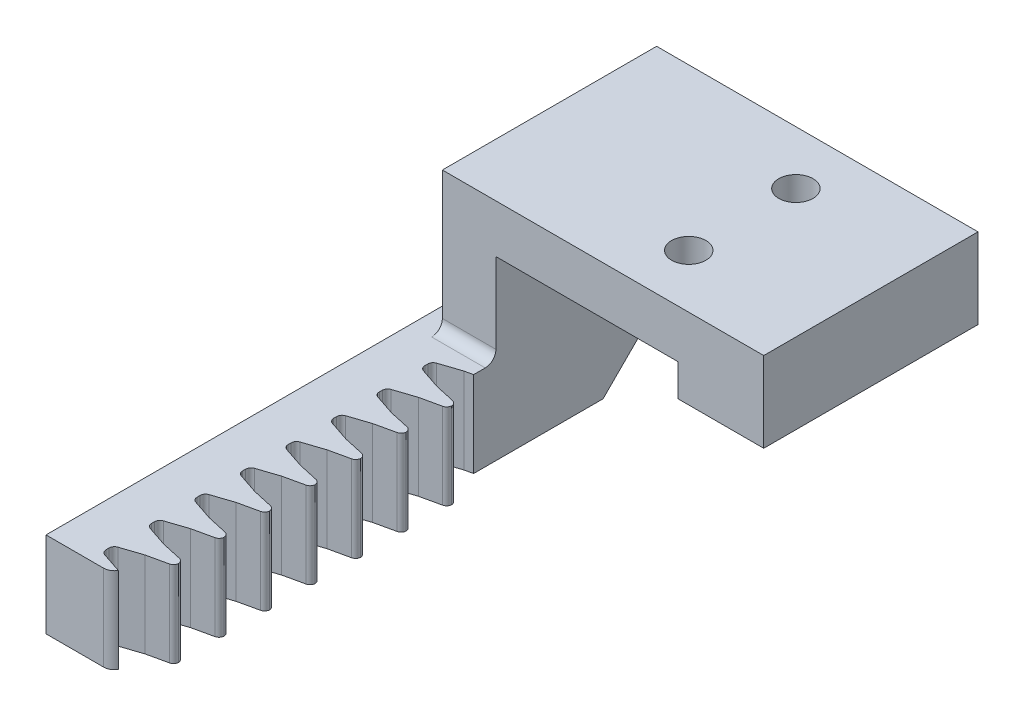
from build123d import *

# Parameters (mm, degrees)
SKETCH1_W           = 30
SKETCH1_H           = 16
BOSS_EXTRUDE1_DEPTH = 20
CUT_EXTRUDE1_DEPTH  = 20
SKETCH3_W           = 6
SKETCH3_H           = 10
BOSS_EXTRUDE2_DEPTH = 5
SKETCH9_R           = 1.6
CUT_EXTRUDE3_DEPTH  = 4.5
SKETCH11_W          = 10
SKETCH11_H          = 8
BOSS_EXTRUDE4_DEPTH = 40
CHAMFER2_SIZE2      = 10
CHAMFER2_SIZE       = 2
FILLET1_R           = 1
CUT_EXTRUDE4_DEPTH  = 8
SKETCH13_W          = 2
SKETCH13_H          = 8
BOSS_EXTRUDE5_DEPTH = 10
LPATTERN1_COUNT     = 8
LPATTERN1_PITCH     = 4.25
FILLET2_R           = 0.5
FILLET3_R           = 1
SKETCH14_W          = 2
SKETCH14_H          = 8
CUT_EXTRUDE5_DEPTH  = 17
CHAMFER9_SIZE       = 5
SKETCH15_W          = 19.120114905
SKETCH15_H          = 8.62957368
CUT_EXTRUDE6_DEPTH  = 1


# Some blends are built 0.0001 mm under size
with BuildPart() as part:
    # Sketch1 → Boss-Extrude1 (new body)
    with BuildSketch(Plane.XY):
        with Locations((15, -8)):
            Rectangle(SKETCH1_W, SKETCH1_H)
    extrude(amount=BOSS_EXTRUDE1_DEPTH)

    # Sketch2 → Cut-Extrude1 (cut)
    with BuildSketch(Plane.XY.offset(20)):
        Polygon((22, -4.5), (22, -7.5), (30, -7.5), (30, -16), (5, -16), (5, -4.5), align=None)
    extrude(amount=-CUT_EXTRUDE1_DEPTH, mode=Mode.SUBTRACT)

    # Sketch3 → Boss-Extrude2 (add)
    with BuildSketch(Plane.XZ.offset(16)):
        with Locations((3, 10)):
            Rectangle(SKETCH3_W, SKETCH3_H)
    extrude(amount=BOSS_EXTRUDE2_DEPTH)

    # Sketch9 → Cut-Extrude3 (cut)
    with BuildSketch(Plane.XZ.offset(4.5)):
        with Locations(Location((18, 15, 0), (0, 0, 270))):
            Circle(SKETCH9_R)
        with Locations(Location((18, 5, 0), (0, 0, 270))):
            Circle(SKETCH9_R)
    extrude(amount=-CUT_EXTRUDE3_DEPTH, mode=Mode.SUBTRACT)

    # Sketch11 → Boss-Extrude4 (add)
    with BuildSketch(Plane.XY.offset(15)):
        with Locations((3, -17)):
            Rectangle(SKETCH11_W, SKETCH11_H)
    extrude(amount=BOSS_EXTRUDE4_DEPTH)

    # Chamfer2
    chamfer2_edges = [part.edges().sort_by_distance(p)[0] for p in [
        (0, -17, 15),
    ]]
    chamfer2_side = [part.faces().sort_by_distance(p)[0] for p in [
        (-0.04, -17, 15),
    ]]
    chamfer(chamfer2_edges, length=CHAMFER2_SIZE - 0.0001, length2=CHAMFER2_SIZE2 - 0.0001, reference=chamfer2_side[0])  # a hair under: the kernel refuses the full size

    # Fillet1
    fillet1_edges = [part.edges().sort_by_distance(p)[0] for p in [
        (2.5, -13, 20),
    ]]
    fillet(fillet1_edges, radius=FILLET1_R)

    # Sketch12 → Cut-Extrude4 (cut)
    with BuildSketch(Plane.XZ.offset(21)):
        Polygon((6.5, 55), (4.25, 54.5), (2, 53.75), (2, 52.75), (4.25, 52), (6.5, 51.5), (6.5, 50.75), (8, 50.75), (8, 55), align=None)
    cut_extrude4 = extrude(amount=-CUT_EXTRUDE4_DEPTH, mode=Mode.SUBTRACT)

    # Sketch13 → Boss-Extrude5 (add)
    with BuildSketch(Plane(origin=(0, 0, 15), x_dir=(-1, 0, 0), z_dir=(0, 0, -1))):
        with Locations((-7, -17)):
            Rectangle(SKETCH13_W, SKETCH13_H)
    extrude(amount=BOSS_EXTRUDE5_DEPTH)

    # LPattern1: Cut-Extrude4 ×8
    with Locations(*[(0, 0, -i * LPATTERN1_PITCH) for i in range(1, LPATTERN1_COUNT)]):
        add(cut_extrude4, mode=Mode.SUBTRACT)

    # Fillet2
    # the kernel refuses this fillet: 0.5 mm, written as the material it adds along each edge
    with BuildSketch(Plane(origin=(2, -21, 52.75), x_dir=(0.9486832980505142, 0, -0.31622776601683683), z_dir=(0, 1, 0)), Plane(origin=(2, -21, 53.75), x_dir=(0, 0, -1), z_dir=(0, 1, 0)), Plane(origin=(2, -21, 48.5), x_dir=(0.9486832980505137, 0, -0.31622776601683833), z_dir=(0, 1, 0)), Plane(origin=(2, -21, 49.5), x_dir=(0, 0, -1), z_dir=(0, 1, 0)), Plane(origin=(2, -21, 44.25), x_dir=(0.9486832980505137, 0, -0.31622776601683833), z_dir=(0, 1, 0)), Plane(origin=(2, -21, 45.25), x_dir=(0, 0, -1), z_dir=(0, 1, 0)), Plane(origin=(2, -21, 35.75), x_dir=(0.9486832980505137, 0, -0.31622776601683833), z_dir=(0, 1, 0)), Plane(origin=(2, -21, 36.75), x_dir=(0, 0, -1), z_dir=(0, 1, 0)), Plane(origin=(2, -21, 40), x_dir=(0.9486832980505137, 0, -0.31622776601683833), z_dir=(0, 1, 0)), Plane(origin=(2, -21, 41), x_dir=(0, 0, -1), z_dir=(0, 1, 0)), Plane(origin=(2, -21, 23), x_dir=(0.9486832980505137, 0, -0.31622776601683833), z_dir=(0, 1, 0)), Plane(origin=(2, -21, 24), x_dir=(0, 0, -1), z_dir=(0, 1, 0)), Plane(origin=(2, -21, 27.25), x_dir=(0.9486832980505137, 0, -0.31622776601683833), z_dir=(0, 1, 0)), Plane(origin=(2, -21, 28.25), x_dir=(0, 0, -1), z_dir=(0, 1, 0)), Plane(origin=(2, -21, 32.5), x_dir=(0, 0, -1), z_dir=(0, 1, 0)), Plane(origin=(2, -21, 31.5), x_dir=(0.9486832980505137, 0, -0.31622776601683833), z_dir=(0, 1, 0))) as fillet2_piece_1:
        with BuildLine():
            CenterArc((FILLET2_R * 0.720759220056, -FILLET2_R), FILLET2_R, 90, 71.565051177)
            Line((-FILLET2_R * 0.227924077994, -FILLET2_R * 0.683772233983), (0, 0))
            Line((0, 0), (FILLET2_R * 0.720759220056, 0))
        make_face()
    extrude(amount=8)
    # the kernel refuses this fillet: 0.5 mm, written as the material it takes off along each edge
    with BuildSketch(Plane(origin=(6.5, -22.002714508, 33.75), x_dir=(-0.9761870601839537, 0, -0.21693045781865147), z_dir=(0, 1, 0)), Plane(origin=(6.5, -22.002714508, 34.5), x_dir=(0, 0, -1), z_dir=(0, 1, 0)), Plane(origin=(6.5, -22.002714508, 38), x_dir=(-0.9761870601839536, 0, -0.21693045781865192), z_dir=(0, 1, 0)), Plane(origin=(6.5, -22.002714508, 38.75), x_dir=(0, 0, -1), z_dir=(0, 1, 0)), Plane(origin=(6.5, -22.002714508, 42.25), x_dir=(-0.9761870601839541, 0, -0.21693045781865056), z_dir=(0, 1, 0)), Plane(origin=(6.5, -22.002714508, 43), x_dir=(0, 0, -1), z_dir=(0, 1, 0)), Plane(origin=(6.5, -22.002714508, 46.5), x_dir=(-0.9761870601839537, 0, -0.21693045781865147), z_dir=(0, 1, 0)), Plane(origin=(6.5, -22.002714508, 47.25), x_dir=(0, 0, -1), z_dir=(0, 1, 0)), Plane(origin=(6.5, -22.002714508, 50.75), x_dir=(-0.9761870601839541, 0, -0.21693045781865006), z_dir=(0, 1, 0)), Plane(origin=(6.5, -22.002714508, 51.5), x_dir=(0, 0, -1), z_dir=(0, 1, 0)), Plane(origin=(6.5, -22.002714508, 25.25), x_dir=(-0.9761870601839524, 0, -0.21693045781865805), z_dir=(0, 1, 0)), Plane(origin=(6.5, -22.002714508, 26), x_dir=(0, 0, -1), z_dir=(0, 1, 0)), Plane(origin=(6.5, -22.002714508, 29.5), x_dir=(-0.9761870601839522, 0, -0.216930457818659), z_dir=(0, 1, 0)), Plane(origin=(6.5, -22.002714508, 30.25), x_dir=(0, 0, -1), z_dir=(0, 1, 0))) as fillet2_2_piece_1:
        with BuildLine():
            CenterArc((FILLET2_R * 0.802171606366, FILLET2_R), FILLET2_R, 192.528807709, 77.471192291)
            Line((-FILLET2_R * 0.174015453818, FILLET2_R * 0.783069542181), (0, 0))
            Line((0, 0), (FILLET2_R * 0.802171606366, 0))
        make_face()
    extrude(amount=10.005429016, mode=Mode.SUBTRACT)

    # Fillet3
    # the kernel refuses this fillet: 1 mm, written as the material it takes off along each edge
    with BuildSketch(Plane(origin=(6.5, -28.790063509, 55), x_dir=(-1, 0, 0), z_dir=(0, 1, 0))) as fillet3_piece_1:
        with BuildLine():
            CenterArc((3.116025404, -1), FILLET3_R, 90, 60)
            Line((2.25, -0.5), (0, 0))
            Line((0, 0), (3.116025404, 0))
        make_face()
    extrude(amount=23.580127019, mode=Mode.SUBTRACT)

    # Sketch14 → Cut-Extrude5 (cut)
    with BuildSketch(Plane(origin=(0, 0, 5), x_dir=(-1, 0, 0), z_dir=(0, 0, -1))):
        with Locations((-7, -17)):
            Rectangle(SKETCH14_W, SKETCH14_H)
    extrude(amount=-CUT_EXTRUDE5_DEPTH, mode=Mode.SUBTRACT)

    # Chamfer9
    # the kernel refuses this chamfer: 5 mm, written as the material it takes off along each edge
    with BuildSketch(Plane(origin=(5, -16, 17.85841494), x_dir=(0, 1, 0), z_dir=(0, 0, -1))) as chamfer9_piece_1_section:
        Polygon((CHAMFER9_SIZE, 0), (0, -CHAMFER9_SIZE), (0, 0), align=None)
    chamfer9_piece_1 = extrude(amount=30.71682988, mode=Mode.PRIVATE)
    chamfer9_piece_1 = split(chamfer9_piece_1, bisect_by=Plane(origin=(5, -22.42920747, 11.42920747), z_dir=(0, -0.7071067811865476, -0.7071067811865476)), keep=Keep.TOP, mode=Mode.PRIVATE)
    add(chamfer9_piece_1, mode=Mode.SUBTRACT)
    with BuildSketch(Plane(origin=(0, -16, -12.85841494), x_dir=(0, 1, 0), z_dir=(0, 0, 1))) as chamfer9_piece_2_section:
        Polygon((CHAMFER9_SIZE, 0), (0, -CHAMFER9_SIZE), (0, 0), align=None)
    chamfer9_piece_2 = extrude(amount=30.71682988, mode=Mode.PRIVATE)
    chamfer9_piece_2 = split(chamfer9_piece_2, bisect_by=Plane(origin=(0, -7.07079253, -3.92920747), z_dir=(0, -0.7071067811865476, -0.7071067811865476)), keep=Keep.TOP, mode=Mode.PRIVATE)
    add(chamfer9_piece_2, mode=Mode.SUBTRACT)
    with BuildSketch(Plane(origin=(0, -3.14158506, 5), x_dir=(1, 0, 0), z_dir=(0, -1, 0))) as chamfer9_piece_3_section:
        Polygon((CHAMFER9_SIZE, 0), (0, CHAMFER9_SIZE), (0, 0), align=None)
    chamfer9_piece_3 = extrude(amount=30.71682988, mode=Mode.PRIVATE)
    chamfer9_piece_3 = split(chamfer9_piece_3, bisect_by=Plane(origin=(0, -9.57079253, -1.42920747), z_dir=(0, -0.707106781186547, -0.7071067811865481)), keep=Keep.TOP, mode=Mode.PRIVATE)
    add(chamfer9_piece_3, mode=Mode.SUBTRACT)
    with BuildSketch(Plane(origin=(18.85841494, -21, 5), x_dir=(0, 0, 1), z_dir=(-1, 0, 0))) as chamfer9_piece_4:
        Polygon((CHAMFER9_SIZE, 0), (0, CHAMFER9_SIZE), (0, 0), align=None)
    extrude(amount=31.71682988, mode=Mode.SUBTRACT)
    with BuildSketch(Plane(origin=(6, -33.85841494, 5), x_dir=(0, 0, 1), z_dir=(0, 1, 0))) as chamfer9_piece_5_section:
        Polygon((CHAMFER9_SIZE, 0), (0, -CHAMFER9_SIZE), (0, 0), align=None)
    chamfer9_piece_5 = extrude(amount=30.71682988, mode=Mode.PRIVATE)
    chamfer9_piece_5 = split(chamfer9_piece_5, bisect_by=Plane(origin=(6, -24.92920747, 13.92920747), z_dir=(0, -0.707106781186547, -0.7071067811865481)), keep=Keep.TOP, mode=Mode.PRIVATE)
    add(chamfer9_piece_5, mode=Mode.SUBTRACT)
    with BuildSketch(Plane(origin=(17.85841494, -16, 0), x_dir=(0, 0, 1), z_dir=(-1, 0, 0))) as chamfer9_piece_6:
        Polygon((CHAMFER9_SIZE, 0), (0, CHAMFER9_SIZE), (0, 0), align=None)
    extrude(amount=30.71682988, mode=Mode.SUBTRACT)

    # Sketch15 → Cut-Extrude6 (cut)
    with BuildSketch(Plane(origin=(6, 0, 0), x_dir=(0, 0, -1), z_dir=(1, 0, 0))):
        with Locations((-12.83373262, -16.68521316)):
            Rectangle(SKETCH15_W, SKETCH15_H)
    extrude(amount=-CUT_EXTRUDE6_DEPTH, mode=Mode.SUBTRACT)


solid = part.part
